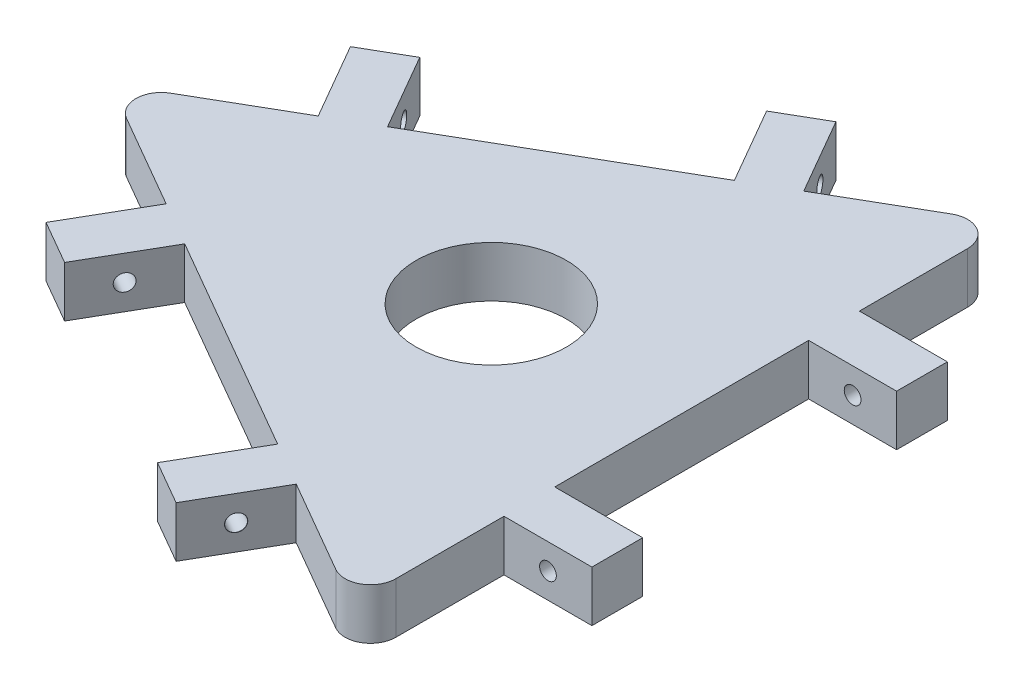
from build123d import *

# Parameters (mm, degrees)
SKETCH2_R                         = 14.798837294
BOSS_EXTRUDE1_DEPTH               = 10
BOSS_EXTRUDE3_DEPTH               = 10
TAP_DRILL_FOR_M4_TAP1_D           = 3.3
TAP_DRILL_FOR_M4_TAP1_CSINK_D     = 3.35
TAP_DRILL_FOR_M4_TAP1_CSINK_ANGLE = 90
CIRPATTERN1_COUNT                 = 3


with BuildPart() as part:
    # Sketch2 → Boss-Extrude1 (new body)
    with BuildSketch(Plane(origin=(0, 0, 0), x_dir=(0, 0, -1), z_dir=(0, 1, 0))):
        with BuildLine():
            Line((-49.975952642, -11.560889132), (-60.621778265, -30))
            ThreePointArc((-60.621778265, -30), (-60.621778265, -35), (-56.291651246, -37.5))
            Line((-56.291651246, -37.5), (-35, -37.5))
            Line((-35, -37.5), (-25, -37.5))
            Line((-25, -37.5), (25, -37.5))
            Line((25, -37.5), (35, -37.5))
            Line((35, -37.5), (56.291651246, -37.5))
            ThreePointArc((56.291651246, -37.5), (60.621778265, -35), (60.621778265, -30))
            Line((60.621778265, -30), (49.975952642, -11.560889132))
            Line((49.975952642, -11.560889132), (44.975952642, -2.900635095))
            Line((44.975952642, -2.900635095), (19.975952642, 40.400635095))
            Line((19.975952642, 40.400635095), (14.975952642, 49.060889132))
            Line((14.975952642, 49.060889132), (4.330127019, 67.5))
            ThreePointArc((4.330127019, 67.5), (0, 70), (-4.330127019, 67.5))
            Line((-4.330127019, 67.5), (-14.975952642, 49.060889132))
            Line((-14.975952642, 49.060889132), (-19.975952642, 40.400635095))
            Line((-19.975952642, 40.400635095), (-44.975952642, -2.900635095))
            Line((-44.975952642, -2.900635095), (-49.975952642, -11.560889132))
        make_face()
        Circle(SKETCH2_R, mode=Mode.SUBTRACT)
    extrude(amount=BOSS_EXTRUDE1_DEPTH)

    # Sketch2<7> → Boss-Extrude3 (add)
    with BuildSketch(Plane(origin=(0, 0, 0), x_dir=(0, 0, -1), z_dir=(0, 1, 0))):
        Polygon((29.975952642, 57.72114317), (14.975952642, 49.060889132), (19.975952642, 40.400635095), (34.975952642, 49.060889132), align=None)
        Polygon((44.975952642, -2.900635095), (49.975952642, -11.560889132), (64.975952642, -2.900635095), (59.975952642, 5.759618943), align=None)
    boss_extrude3 = extrude(amount=BOSS_EXTRUDE3_DEPTH)

    # Tap Drill for M4 Tap1 (through all)
    with Locations(Plane(origin=(-30.310889132, 0, 17.5), x_dir=(0.49999999999999517, 0, 0.8660254037844415), z_dir=(-0.8660254037844414, 0, 0.4999999999999951))):
        with Locations((-46.160254038, 5)):
            tap_drill_for_m4_tap1 = CounterSinkHole(TAP_DRILL_FOR_M4_TAP1_D / 2, TAP_DRILL_FOR_M4_TAP1_CSINK_D / 2, counter_sink_angle=TAP_DRILL_FOR_M4_TAP1_CSINK_ANGLE)

    # CirPattern1: Boss-Extrude3, Tap Drill for M4 Tap1 ×3 about axis
    cirpattern1_axis = Axis((0, 10, 0), (0, 1, 0))
    add([boss_extrude3.rotate(cirpattern1_axis, i * 360 / CIRPATTERN1_COUNT) for i in range(1, CIRPATTERN1_COUNT)])
    add([tap_drill_for_m4_tap1.rotate(cirpattern1_axis, i * 360 / CIRPATTERN1_COUNT) for i in range(1, CIRPATTERN1_COUNT)], mode=Mode.SUBTRACT)


solid = part.part
